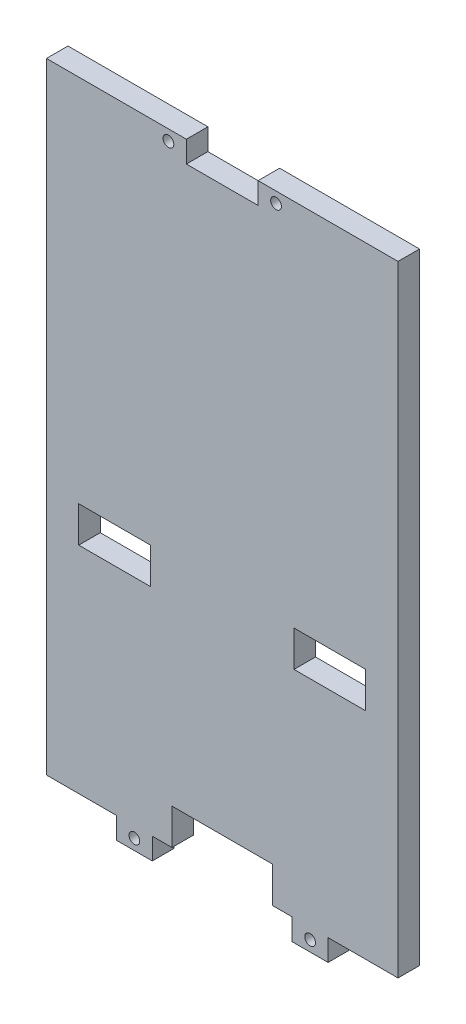
from build123d import *

# Parameters (mm, degrees)
ESQUISSE1_W             = 98
ESQUISSE1_H             = 173
ESQUISSE1_W_2           = 20
ESQUISSE1_H_2           = 10
BOSS_EXTRU_1_DEPTH      = 6
ESQUISSE2_W             = 10
ESQUISSE2_H             = 6
BOSS_EXTRU_2_DEPTH      = 6
ESQUISSE3_R             = 1.5
ENL_V_MAT_EXTRU_1_DEPTH = 6
ESQUISSE4_W             = 20
ESQUISSE4_H             = 6
ESQUISSE4_W_2           = 28
ESQUISSE4_H_2           = 10
ENL_V_MAT_EXTRU_2_DEPTH = 6


with BuildPart() as part:
    # Esquisse1 → Boss.-Extru.1 (new body)
    with BuildSketch(Plane.XY):
        Rectangle(ESQUISSE1_W, ESQUISSE1_H)
        with Locations((30, -21.5)):
            Rectangle(ESQUISSE1_W_2, ESQUISSE1_H_2, mode=Mode.SUBTRACT)
        with Locations((-30, -21.5)):
            Rectangle(ESQUISSE1_W_2, ESQUISSE1_H_2, mode=Mode.SUBTRACT)
    extrude(amount=BOSS_EXTRU_1_DEPTH)

    # Esquisse2 → Boss.-Extru.2 (add)
    with BuildSketch(Plane.XY.offset(6)):
        with Locations((24.5, -89.5)):
            Rectangle(ESQUISSE2_W, ESQUISSE2_H)
        with Locations((-24.5, -89.5)):
            Rectangle(ESQUISSE2_W, ESQUISSE2_H)
    extrude(amount=-BOSS_EXTRU_2_DEPTH)

    # Esquisse3 → Enlèv. mat.-Extru.1 (cut)
    with BuildSketch(Plane.XY.offset(6)):
        with Locations((-15, 83.5)):
            Circle(ESQUISSE3_R)
        with Locations((24.5, -89.5)):
            Circle(ESQUISSE3_R)
        with Locations((-24.5, -89.5)):
            Circle(ESQUISSE3_R)
        with Locations((15, 83.5)):
            Circle(ESQUISSE3_R)
    extrude(amount=-ENL_V_MAT_EXTRU_1_DEPTH, mode=Mode.SUBTRACT)

    # Esquisse4 → Enlèv. mat.-Extru.2 (cut)
    with BuildSketch(Plane.XY.offset(6)):
        with Locations((0, 83.5)):
            Rectangle(ESQUISSE4_W, ESQUISSE4_H)
        with Locations((0, -81.5)):
            Rectangle(ESQUISSE4_W_2, ESQUISSE4_H_2)
    extrude(amount=-ENL_V_MAT_EXTRU_2_DEPTH, mode=Mode.SUBTRACT)


solid = part.part
